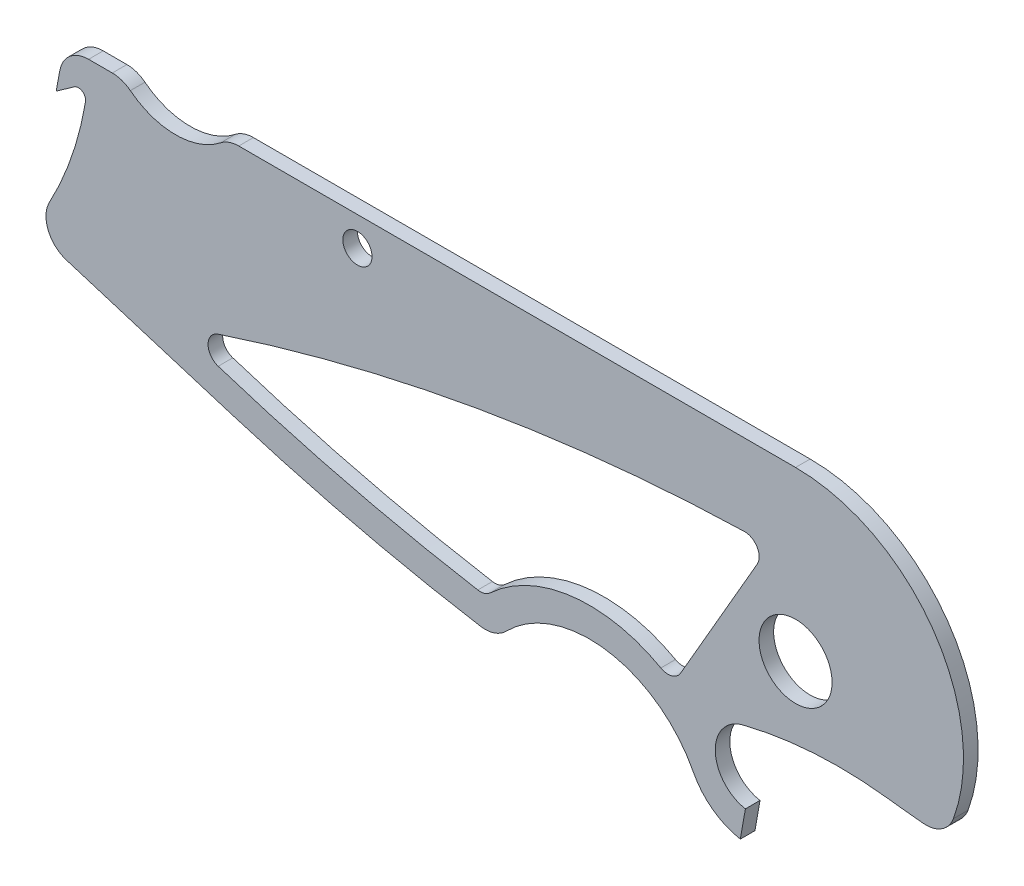
from build123d import *

# Parameters (mm, degrees)
SKICA1_R                       = 2.5
P_IDAT_VYSUNUT_M1_DEPTH        = 1
ODEBRAT_VYSUNUT_M13_DEPTH      = 53.848376335
ODEBRAT_VYSUNUT_M13_DEPTH_BACK = 53.848376335
ODEBRAT_VYSUNUT_M12_DEPTH      = 53.819985623
ODEBRAT_VYSUNUT_M12_DEPTH_BACK = 53.819985623
SKICA16_R                      = 1
ODEBRAT_VYSUNUT_M15_DEPTH      = 53.819985623


with BuildPart() as part:
    # Skica1 → Přidat vysunutím1 (new body)
    with BuildSketch(Plane.XY):
        with BuildLine():
            Line((0, 11.5), (-38.12638963, 11.5))
            ThreePointArc((-38.12638963, 11.5), (-38.781043301, 11.389822365), (-39.363568778, 11.071428571))
            ThreePointArc((-39.363568778, 11.071428571), (-42.456516649, 10), (-45.54946452, 11.071428571))
            ThreePointArc((-45.54946452, 11.071428571), (-46.131989997, 11.389822365), (-46.786643668, 11.5))
            Line((-46.786643668, 11.5), (-48.408633974, 11.5))
            ThreePointArc((-48.408633974, 11.5), (-49.6794032, 11.044391652), (-50.371199358, 9.885145575))
            ThreePointArc((-50.371199358, 9.885145575), (-51.052595276, 5.348489828), (-51.326233925, 0.769115673))
            ThreePointArc((-51.326233925, 0.769115673), (-50.944425281, -0.436513563), (-49.915705076, -1.172077587))
            Line((-49.915705076, -1.172077587), (-38.448343472, -4.707557447))
            ThreePointArc((-38.448343472, -4.707557447), (-30.083835229, -6.985089116), (-21.586571164, -8.70225307))
            ThreePointArc((-21.586571164, -8.70225307), (-20.636415349, -8.631497124), (-19.826816212, -8.129150916))
            ThreePointArc((-19.826816212, -8.129150916), (-12.91933355, -5.81580451), (-7, -10.061552813))
            ThreePointArc((-7, -10.061552813), (-5.668297006, -11.623560554), (-3.7814168, -12.431634889))
            Line((-3.7814168, -12.431634889), (-3.434120444, -10.462019383))
            ThreePointArc((-3.434120444, -10.462019383), (-5.49842143, -8.088827697), (-3.607870264, -5.575027064))
            ThreePointArc((-3.607870264, -5.575027064), (1.253972452, -4.817482892), (6.172618029, -4.952810098))
            ThreePointArc((6.172618029, -4.952810098), (7.453089356, -5.098574184), (8.735006444, -5.231022544))
            ThreePointArc((8.735006444, -5.231022544), (9.996764724, -4.932454173), (10.810257225, -3.92279731))
            ThreePointArc((10.810257225, -3.92279731), (9.417063477, 6.60067538), (0, 11.5))
        make_face()
        Circle(SKICA1_R, mode=Mode.SUBTRACT)
    extrude(amount=P_IDAT_VYSUNUT_M1_DEPTH)

    # Skica14 → Odebrat vysunutím13 (cut, two sides: drawn at the far end of the back side and taken through both)
    with BuildSketch(Plane.XY.offset(2).offset(-ODEBRAT_VYSUNUT_M13_DEPTH_BACK)):
        with BuildLine():
            Line((-7.869119097, -4.629714086), (-2.626247089, 4.451206608))
            ThreePointArc((-2.626247089, 4.451206608), (-2.633316833, 5.46325658), (-3.520210673, 5.950816261))
            ThreePointArc((-3.520210673, 5.950816261), (-21.76179058, 4.106504546), (-39.542588665, -0.365625))
            ThreePointArc((-39.542588665, -0.365625), (-40.228753357, -1.318341197), (-39.536435135, -2.26659518))
            ThreePointArc((-39.536435135, -2.26659518), (-30.725306719, -4.772615293), (-21.758030683, -6.644534429))
            ThreePointArc((-21.758030683, -6.644534429), (-21.304038727, -6.617599792), (-20.908925998, -6.392388554))
            ThreePointArc((-20.908925998, -6.392388554), (-15.292534392, -3.796568873), (-9.223868738, -5.002152405))
            ThreePointArc((-9.223868738, -5.002152405), (-8.470065988, -5.093940917), (-7.869119097, -4.629714086))
        make_face()
    extrude(amount=ODEBRAT_VYSUNUT_M13_DEPTH + ODEBRAT_VYSUNUT_M13_DEPTH_BACK, mode=Mode.SUBTRACT)

    # Skica13 → Odebrat vysunutím12 (cut, two sides: drawn at the far end of the back side and taken through both)
    with BuildSketch(Plane.XY.offset(-ODEBRAT_VYSUNUT_M12_DEPTH_BACK)):
        with BuildLine():
            Line((-165.547965178, -73.379828616), (-50.623352594, 8.5))
            Line((-50.623352594, 8.5), (-49.401701576, 9.370384278))
            ThreePointArc((-49.401701576, 9.370384278), (-48.846381241, 9.38704588), (-48.618476036, 8.880372908))
            ThreePointArc((-48.618476036, 8.880372908), (-49.55655452, 5.183086079), (-51.08654298, 1.688940053))
            ThreePointArc((-51.08654298, 1.688940053), (-51.261828191, 1.243474537), (-51.326233925, 0.769115673))
            Line((-51.326233925, 0.769115673), (-53.440504935, -140.324834481))
            Line((-53.440504935, -140.324834481), (-198.133246531, -382.630224799))
            Line((-198.133246531, -382.630224799), (-310.240706774, -315.685218935))
            Line((-310.240706774, -315.685218935), (-165.547965178, -73.379828616))
        make_face()
    extrude(amount=ODEBRAT_VYSUNUT_M12_DEPTH + ODEBRAT_VYSUNUT_M12_DEPTH_BACK, mode=Mode.SUBTRACT)

    # Skica16 → Odebrat vysunutím15 (cut, through all)
    with BuildSketch(Plane.XY):
        with Locations((-30, 9.5)):
            Circle(SKICA16_R)
    extrude(amount=ODEBRAT_VYSUNUT_M15_DEPTH, mode=Mode.SUBTRACT)


solid = part.part
